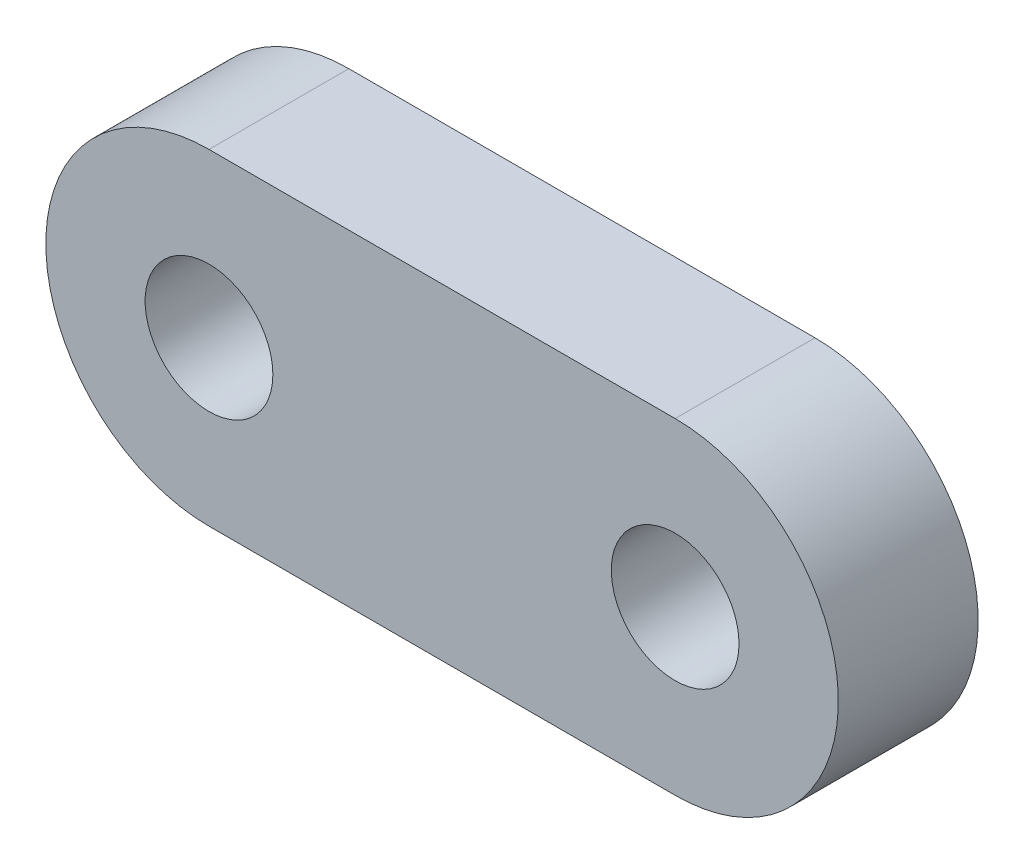
from build123d import *

# Parameters (mm, degrees)
BOSS_EXTRUDE1_DEPTH = 3.81
SKETCH2_R           = 1.7399
CUT_EXTRUDE1_DEPTH  = 19.116985124


with BuildPart() as part:
    # Sketch1 → Boss-Extrude1 (new body)
    with BuildSketch(Plane.XY):
        with BuildLine():
            Line((0, 4.445), (12.7, 4.445))
            ThreePointArc((12.7, 4.445), (17.145, 0), (12.7, -4.445))
            Line((12.7, -4.445), (0, -4.445))
            ThreePointArc((0, -4.445), (-4.445, 0), (0, 4.445))
        make_face()
    extrude(amount=BOSS_EXTRUDE1_DEPTH)

    # Sketch2 → Cut-Extrude1 (cut, symmetric)
    with BuildSketch(Plane.XY.offset(3.81)):
        Circle(SKETCH2_R)
    cut_extrude1 = extrude(amount=CUT_EXTRUDE1_DEPTH, both=True, mode=Mode.SUBTRACT)

    # Mirror1: Cut-Extrude1 across plane
    add(cut_extrude1.mirror(Plane(origin=(6.35, 0, 0), x_dir=(0, 0, 1), z_dir=(1, 0, 0))), mode=Mode.SUBTRACT)


solid = part.part
